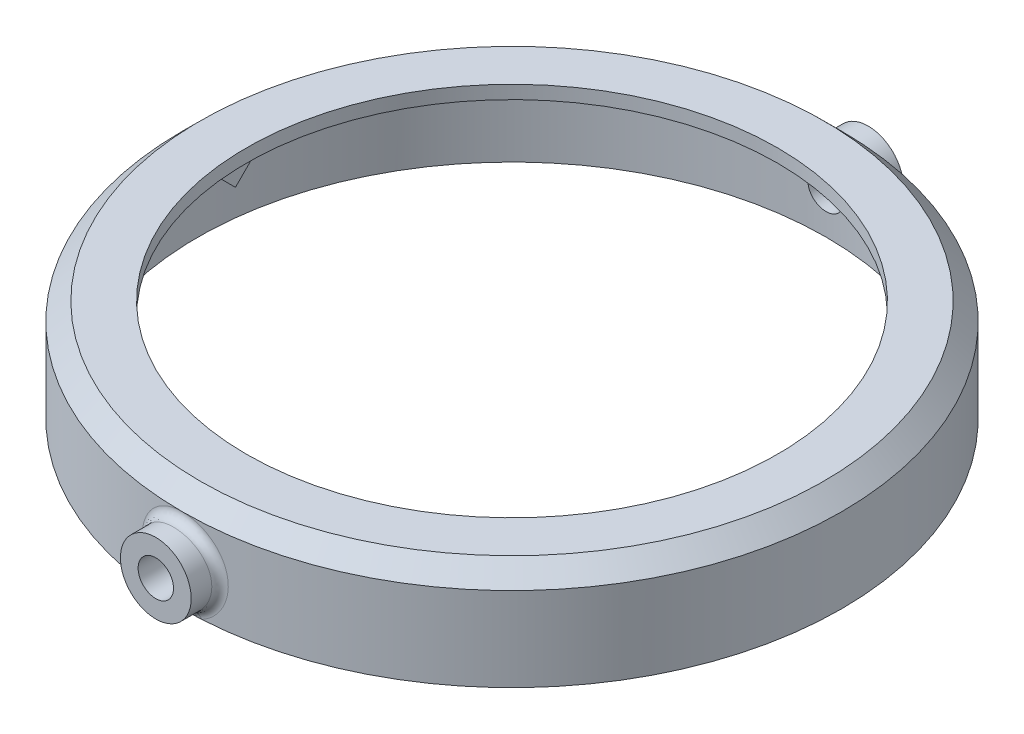
from build123d import *

# Parameters (mm, degrees)
SKETCH1_R           = 37.25
SKETCH1_R_2         = 35.5
BOSS_EXTRUDE1_DEPTH = 10
BOSS_EXTRUDE2_START = 1.5
SKETCH1_2_R         = 37.25
SKETCH1_2_R_2       = 30
BOSS_EXTRUDE2_DEPTH = 1.5
CHAMFER1_SIZE       = 1.5
CHAMFER2_SIZE       = 2
CUT_EXTRUDE1_DEPTH  = 10
BOSS_EXTRUDE4_START = 3
BOSS_EXTRUDE4_DEPTH = 4
BOSS_EXTRUDE6_START = -1
BOSS_EXTRUDE6_DEPTH = 5
FILLET1_R           = 1


with BuildPart() as part:
    # Sketch1 → Boss-Extrude1 (new body)
    with BuildSketch(Plane(origin=(0, 0, 0), x_dir=(1, 0, 0), z_dir=(0, 1, 0))):
        with Locations(Location((0, 0, 0), (0, 0, 270))):
            Circle(SKETCH1_R)
        with Locations(Location((0, 0, 0), (0, 0, 270))):
            Circle(SKETCH1_R_2, mode=Mode.SUBTRACT)
    extrude(amount=-BOSS_EXTRUDE1_DEPTH)

    # Sketch1<2> → Boss-Extrude2 (add)
    with BuildSketch(Plane(origin=(0, 0, 0), x_dir=(1, 0, 0), z_dir=(0, 1, 0)).offset(BOSS_EXTRUDE2_START)):
        with Locations(Location((0, 0, 0), (0, 0, 270))):
            Circle(SKETCH1_2_R)
        with Locations(Location((0, 0, 0), (0, 0, 270))):
            Circle(SKETCH1_2_R_2, mode=Mode.SUBTRACT)
    extrude(amount=-BOSS_EXTRUDE2_DEPTH)

    # Chamfer1
    chamfer1_edges = [part.edges().sort_by_distance(p)[0] for p in [
        (0, 0, -35.5),
    ]]
    chamfer(chamfer1_edges, length=CHAMFER1_SIZE)

    # Chamfer2
    chamfer2_edges = [part.edges().sort_by_distance(p)[0] for p in [
        (0, 1.5, -37.25),
    ]]
    chamfer(chamfer2_edges, length=CHAMFER2_SIZE)

    # Sketch2 → Cut-Extrude1 (cut)
    with BuildSketch(Plane.XY.offset(37.25)):
        with BuildLine():
            ThreePointArc((2, -5.5), (1.414213562, -4.085786438), (0, -3.5))
            Line((0, -3.5), (0, -7.5))
            ThreePointArc((0, -7.5), (1.414213562, -6.914213562), (2, -5.5))
        make_face()
        with BuildLine():
            Line((0, -7.5), (0, -3.5))
            ThreePointArc((0, -3.5), (-2, -5.5), (0, -7.5))
        make_face()
    cut_extrude1 = extrude(amount=-CUT_EXTRUDE1_DEPTH, mode=Mode.SUBTRACT)

    # Sketch2<3> → Boss-Extrude4 (add)
    with BuildSketch(Plane.XY.offset(37.25).offset(BOSS_EXTRUDE4_START)):
        with BuildLine():
            ThreePointArc((4, -5.5), (2.828427125, -2.671572875), (0, -1.5))
            Line((0, -1.5), (0, -3.5))
            ThreePointArc((0, -3.5), (1.414213562, -4.085786438), (2, -5.5))
            ThreePointArc((2, -5.5), (1.414213562, -6.914213562), (0, -7.5))
            Line((0, -7.5), (0, -9.5))
            ThreePointArc((0, -9.5), (2.828427125, -8.328427125), (4, -5.5))
        make_face()
        with BuildLine():
            Line((0, -3.5), (0, -1.5))
            ThreePointArc((0, -1.5), (-4, -5.5), (0, -9.5))
            Line((0, -9.5), (0, -7.5))
            ThreePointArc((0, -7.5), (-2, -5.5), (0, -3.5))
        make_face()
    boss_extrude4 = extrude(amount=-BOSS_EXTRUDE4_DEPTH)

    # Mirror1: Cut-Extrude1, Boss-Extrude4 across plane
    add(cut_extrude1.mirror(Plane.XY), mode=Mode.SUBTRACT)
    add(boss_extrude4.mirror(Plane.XY))

    # tirangle → Boss-Extrude6 (add)
    with BuildSketch(Plane(origin=(37.25, 0, 0), x_dir=(0, 0, -1), z_dir=(1, 0, 0)).offset(BOSS_EXTRUDE6_START)):
        Polygon((2.5, -0.5), (-2.5, -0.5), (0, -3), align=None)
    boss_extrude6 = extrude(amount=-BOSS_EXTRUDE6_DEPTH)

    # Mirror2: Boss-Extrude6 across plane
    add(boss_extrude6.mirror(Plane(origin=(0, 0, 0), x_dir=(0, 0, 1), z_dir=(1, 0, 0))))

    # Fillet1
    fillet1_edges = [part.edges().sort_by_distance(p)[0] for p in [
        (-4, -5.500000006, 37.034612189),
        (-4.8e-08, -9.5, -37.25),
    ]]
    fillet(fillet1_edges, radius=FILLET1_R - 0.0001)  # a hair under: the kernel refuses the full size


solid = part.part
